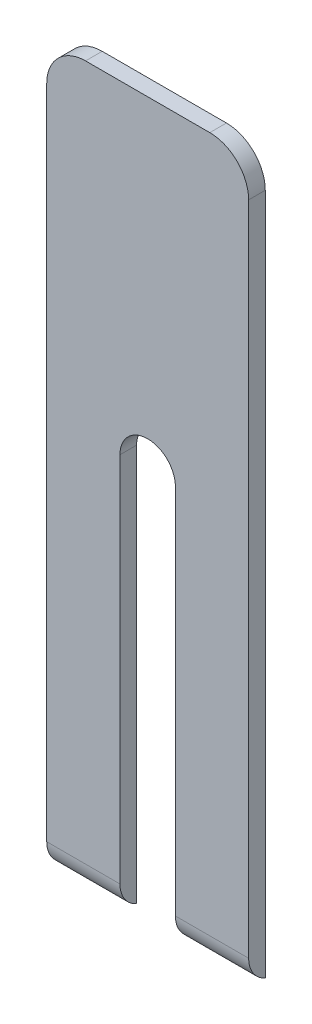
from build123d import *

# Parameters (mm, degrees)
EXTRUDE_1_DEPTH = 0.3
FILLET_1_R      = 0.5


with BuildPart() as part:
    # 草图1 → 凸台-拉伸1 (new body)
    with BuildSketch(Plane.XY):
        with BuildLine():
            Line((0, 0), (0, 12.3))
            ThreePointArc((0, 12.3), (0.205025253, 12.794974747), (0.7, 13))
            Line((0.7, 13), (2.94, 13))
            ThreePointArc((2.94, 13), (3.434974747, 12.794974747), (3.64, 12.3))
            Line((3.64, 12.3), (3.64, 0))
            Line((3.64, 0), (2.32, 0))
            Line((2.32, 0), (2.32, 7.16))
            ThreePointArc((2.32, 7.16), (1.82, 7.66), (1.32, 7.16))
            Line((1.32, 7.16), (1.32, 0))
            Line((1.32, 0), (0, 0))
        make_face()
    extrude(amount=EXTRUDE_1_DEPTH)

    # 圆角1
    # the kernel refuses this fillet: 0.5 mm, written as the material it takes off along each edge
    with BuildSketch(Plane(origin=(2.465643924, 0, 0.3), x_dir=(0, 0, -1), z_dir=(-1, 0, 0)), Plane(origin=(4.785643924, 0, 0.3), x_dir=(0, 0, -1), z_dir=(-1, 0, 0))) as fillet_1_piece_1:
        with BuildLine():
            CenterArc((0.5, -0.458257569), FILLET_1_R, 113.578178478, 66.421821522)
            Line((0, -0.458257569), (-0.01, -0.458257569))
            Line((-0.01, -0.458257569), (-0.01, 0))
            Line((-0.01, 0), (0, 0.01))
            ThreePointArc((0, 0.01), (0.15, 0.01), (0.296, 0.009165151))
            Line((0.296, 0.009165151), (0.3, 0))
        make_face()
    extrude(amount=3.611287847, mode=Mode.SUBTRACT)


solid = part.part
